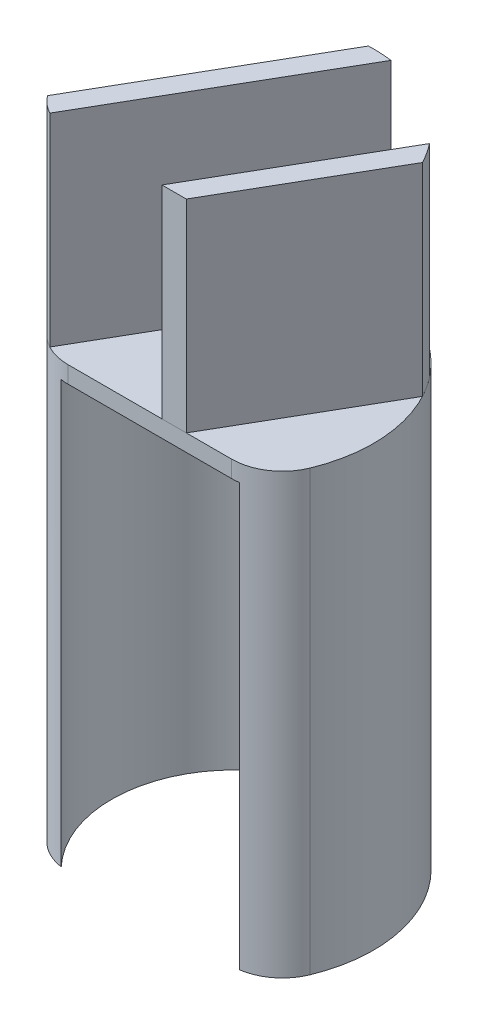
from build123d import *

# Parameters (mm, degrees)
SKETCH_1_R          = 16.5
SKETCH_1_R_2        = 14.5
EXTRUDE_1_DEPTH     = 35
SKETCH_3_R          = 16.5
EXTRUDE_2_DEPTH     = 2
SKETCH_4_W          = 49.747728002
SKETCH_4_H          = 43.690708299
CUT_EXTRUDE_1_DEPTH = 49.40970977
CUT_EXTRUDE_2_REACH = 45.744
SKETCH_5_R          = 3.75
FILLET_1_R          = 6
EXTRUDE_3_DEPTH     = 24
EXTRUDE_3_2_DEPTH   = 24
EXTRUDE_START       = 15
EXTRUDE_4_DEPTH     = 15


with BuildPart() as part:
    # 草图1 → 凸台-拉伸1 (new body)
    with BuildSketch(Plane(origin=(0, 0, 0), x_dir=(1, 0, 0), z_dir=(0, 1, 0))):
        Circle(SKETCH_1_R)
        Circle(SKETCH_1_R_2, mode=Mode.SUBTRACT)
    extrude(amount=EXTRUDE_1_DEPTH)

    # 草图3 → 凸台-拉伸2 (add)
    with BuildSketch(Plane(origin=(0, 35, 0), x_dir=(1, 0, 0), z_dir=(0, 1, 0))):
        Circle(SKETCH_3_R)
    extrude(amount=EXTRUDE_2_DEPTH)

    # 草图4 → 切除-拉伸1 (cut, through all)
    with BuildSketch(Plane.XY.offset(10)):
        with Locations((3.540684312, 17.876483266)):
            Rectangle(SKETCH_4_W, SKETCH_4_H)
    extrude(amount=CUT_EXTRUDE_1_DEPTH, mode=Mode.SUBTRACT)

    # 草图5 → 切除-拉伸2 (cut, up to next)
    with BuildSketch(Plane(origin=(0, 37, 0), x_dir=(1, 0, 0), z_dir=(0, 1, 0)), mode=Mode.PRIVATE) as cut_extrude_2_sk1:
        Circle(SKETCH_5_R)
    cut_extrude_2_tool1 = extrude(cut_extrude_2_sk1.sketch, amount=-CUT_EXTRUDE_2_REACH, mode=Mode.PRIVATE) & part.part
    add(cut_extrude_2_tool1.solids().sort_by_distance((0, 37, 0))[0], mode=Mode.SUBTRACT)

    # 圆角1
    fillet_1_edges = [part.edges().sort_by_distance(p)[0] for p in [
        (-13.124404748, 18.5, 10),
        (13.124404748, 18.5, 10),
    ]]
    fillet(fillet_1_edges, radius=FILLET_1_R)

    # 草图7 → 凸台-拉伸4 (add)
    with BuildSketch(Plane.XZ.offset(EXTRUDE_START)):
        with BuildLine():
            ThreePointArc((-10.557154474, 9.939642318), (0, -14.5), (10.557154474, 9.939642318))
            ThreePointArc((10.557154474, 9.939642318), (13.391521243, 8.736398226), (15.255811873, 6.285714286))
            ThreePointArc((15.255811873, 6.285714286), (0, -16.5), (-15.255811873, 6.285714286))
            ThreePointArc((-15.255811873, 6.285714286), (-13.391521243, 8.736398226), (-10.557154474, 9.939642318))
        make_face()
    extrude(amount=-EXTRUDE_4_DEPTH)


with BuildPart() as body_2:
    # 草图6 → 凸台-拉伸3 (new body)
    with BuildSketch(Plane(origin=(0, 37, 0), x_dir=(1, 0, 0), z_dir=(0, 1, 0))):
        with BuildLine():
            Line((13.047897801, 10.099621923), (1.443375673, -10))
            Line((1.443375673, -10), (4.330127019, -10))
            Line((4.330127019, -10), (14.5721397, 7.739686335))
            ThreePointArc((14.5721397, 7.739686335), (13.860337004, 8.952153826), (13.047897801, 10.099621923))
        make_face()
    extrude(amount=EXTRUDE_3_DEPTH)


with BuildPart() as body_3:
    # 草图6 → Extrude 3 2 (new body)
    with BuildSketch(Plane(origin=(0, 37, 0), x_dir=(1, 0, 0), z_dir=(0, 1, 0))):
        with BuildLine():
            Line((-0.583304866, 16.489686335), (-14.498767089, -7.612601246))
            ThreePointArc((-14.498767089, -7.612601246), (-13.623792058, -8.546260307), (-12.570735662, -9.273152854))
            Line((-12.570735662, -9.273152854), (2.222580253, 16.349621923))
            ThreePointArc((2.222580253, 16.349621923), (0.82262413, 16.479480864), (-0.583304866, 16.489686335))
        make_face()
    extrude(amount=EXTRUDE_3_2_DEPTH)


solid = Compound([part.part, body_2.part, body_3.part])
